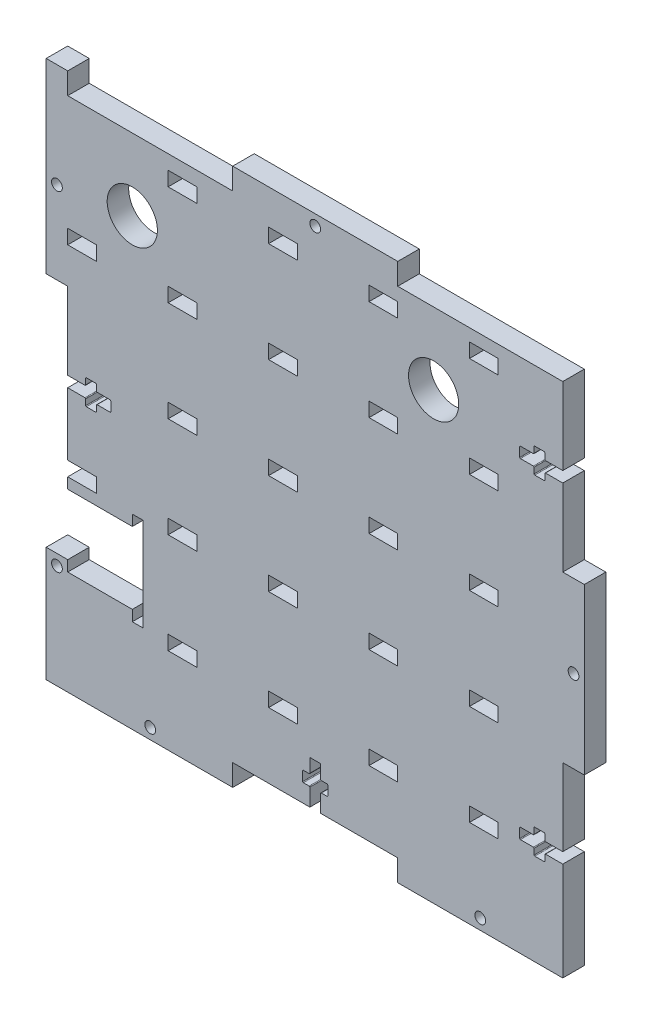
from build123d import *

# Parameters (mm, degrees)
BOX_SIDE_DEPTH       = 6
SKETCH2_R            = 1.5
SCREW_CUT_OUTS_DEPTH = 107.235587258
CUT_EXTRUDE1_DEPTH   = 107.235587258
SKETCH4_W            = 8
SKETCH4_H            = 4
CUT_EXTRUDE2_DEPTH   = 107.235587258
SKETCH5_R            = 7
CUT_EXTRUDE3_DEPTH   = 107.235587258
SKETCH6_W            = 6
SKETCH6_H            = 6
BOSS_EXTRUDE1_DEPTH  = 6


with BuildPart() as part:
    # Sketch1 → Box Side (new body)
    with BuildSketch(Plane.XY):
        Polygon((-69, 69), (-23, 69), (-23, 75), (23, 75), (23, 69), (69, 69), (69, 23), (75, 23), (75, -23), (69, -23), (69, -69), (69, -75), (23, -75), (23, -69), (-23, -69), (-23, -75), (-69, -75), (-75, -75), (-75, -69), (-75, -23), (-69, -23), (-69, 23), (-75, 23), (-75, 69), align=None)
    extrude(amount=BOX_SIDE_DEPTH)

    # Sketch2 → Screw Cut-outs (cut, through all)
    with BuildSketch(Plane.XY.offset(6)):
        with Locations((0, 72)):
            Circle(SKETCH2_R)
        with Locations((72, 0)):
            Circle(SKETCH2_R)
        with Locations((-46, -72)):
            Circle(SKETCH2_R)
        with Locations((46, -72)):
            Circle(SKETCH2_R)
        with Locations((-72, 46)):
            Circle(SKETCH2_R)
        with Locations((-72, -46)):
            Circle(SKETCH2_R)
        with BuildLine():
            Line((69, 44.5), (64.2, 44.5))
            ThreePointArc((64.2, 44.5), (64.058578644, 44.441421356), (64, 44.3))
            Line((64, 44.3), (64, 42.7))
            ThreePointArc((64, 42.7), (63.941421356, 42.558578644), (63.8, 42.5))
            Line((63.8, 42.5), (61.2, 42.5))
            ThreePointArc((61.2, 42.5), (61.058578644, 42.558578644), (61, 42.7))
            Line((61, 42.7), (61, 44.3))
            ThreePointArc((61, 44.3), (60.941421356, 44.441421356), (60.8, 44.5))
            Line((60.8, 44.5), (57.2, 44.5))
            ThreePointArc((57.2, 44.5), (57.058578644, 44.558578644), (57, 44.7))
            Line((57, 44.7), (57, 47.3))
            ThreePointArc((57, 47.3), (57.058578644, 47.441421356), (57.2, 47.5))
            Line((57.2, 47.5), (60.8, 47.5))
            ThreePointArc((60.8, 47.5), (60.941421356, 47.558578644), (61, 47.7))
            Line((61, 47.7), (61, 49.3))
            ThreePointArc((61, 49.3), (61.058578644, 49.441421356), (61.2, 49.5))
            Line((61.2, 49.5), (63.8, 49.5))
            ThreePointArc((63.8, 49.5), (63.941421356, 49.441421356), (64, 49.3))
            Line((64, 49.3), (64, 47.7))
            ThreePointArc((64, 47.7), (64.058578644, 47.558578644), (64.2, 47.5))
            Line((64.2, 47.5), (69, 47.5))
            Line((69, 47.5), (69, 44.5))
        make_face()
        with BuildLine():
            Line((69, -47.5), (64.2, -47.5))
            ThreePointArc((64.2, -47.5), (64.058578644, -47.558578644), (64, -47.7))
            Line((64, -47.7), (64, -49.3))
            ThreePointArc((64, -49.3), (63.941421356, -49.441421356), (63.8, -49.5))
            Line((63.8, -49.5), (61.2, -49.5))
            ThreePointArc((61.2, -49.5), (61.058578644, -49.441421356), (61, -49.3))
            Line((61, -49.3), (61, -47.7))
            ThreePointArc((61, -47.7), (60.941421356, -47.558578644), (60.8, -47.5))
            Line((60.8, -47.5), (57.2, -47.5))
            ThreePointArc((57.2, -47.5), (57.058578644, -47.441421356), (57, -47.3))
            Line((57, -47.3), (57, -44.7))
            ThreePointArc((57, -44.7), (57.058578644, -44.558578644), (57.2, -44.5))
            Line((57.2, -44.5), (60.8, -44.5))
            ThreePointArc((60.8, -44.5), (60.941421356, -44.441421356), (61, -44.3))
            Line((61, -44.3), (61, -42.7))
            ThreePointArc((61, -42.7), (61.058578644, -42.558578644), (61.2, -42.5))
            Line((61.2, -42.5), (63.8, -42.5))
            ThreePointArc((63.8, -42.5), (63.941421356, -42.558578644), (64, -42.7))
            Line((64, -42.7), (64, -44.3))
            ThreePointArc((64, -44.3), (64.058578644, -44.441421356), (64.2, -44.5))
            Line((64.2, -44.5), (69, -44.5))
            Line((69, -44.5), (69, -47.5))
        make_face()
        with BuildLine():
            Line((-1.5, -69), (1.5, -69))
            Line((1.5, -69), (1.5, -64.2))
            ThreePointArc((1.5, -64.2), (1.558578644, -64.058578644), (1.7, -64))
            Line((1.7, -64), (3.3, -64))
            ThreePointArc((3.3, -64), (3.441421356, -63.941421356), (3.5, -63.8))
            Line((3.5, -63.8), (3.5, -61.2))
            ThreePointArc((3.5, -61.2), (3.441421356, -61.058578644), (3.3, -61))
            Line((3.3, -61), (1.7, -61))
            ThreePointArc((1.7, -61), (1.558578644, -60.941421356), (1.5, -60.8))
            Line((1.5, -60.8), (1.5, -57.2))
            ThreePointArc((1.5, -57.2), (1.441421356, -57.058578644), (1.3, -57))
            Line((1.3, -57), (-1.3, -57))
            ThreePointArc((-1.3, -57), (-1.441421356, -57.058578644), (-1.5, -57.2))
            Line((-1.5, -57.2), (-1.5, -60.8))
            ThreePointArc((-1.5, -60.8), (-1.558578644, -60.941421356), (-1.7, -61))
            Line((-1.7, -61), (-3.3, -61))
            ThreePointArc((-3.3, -61), (-3.441421356, -61.058578644), (-3.5, -61.2))
            Line((-3.5, -61.2), (-3.5, -63.8))
            ThreePointArc((-3.5, -63.8), (-3.441421356, -63.941421356), (-3.3, -64))
            Line((-3.3, -64), (-1.7, -64))
            ThreePointArc((-1.7, -64), (-1.558578644, -64.058578644), (-1.5, -64.2))
            Line((-1.5, -64.2), (-1.5, -69))
        make_face()
        with BuildLine():
            Line((-69, -1.5), (-64.2, -1.5))
            ThreePointArc((-64.2, -1.5), (-64.058578644, -1.558578644), (-64, -1.7))
            Line((-64, -1.7), (-64, -3.3))
            ThreePointArc((-64, -3.3), (-63.941421356, -3.441421356), (-63.8, -3.5))
            Line((-63.8, -3.5), (-61.2, -3.5))
            ThreePointArc((-61.2, -3.5), (-61.058578644, -3.441421356), (-61, -3.3))
            Line((-61, -3.3), (-61, -1.7))
            ThreePointArc((-61, -1.7), (-60.941421356, -1.558578644), (-60.8, -1.5))
            Line((-60.8, -1.5), (-57.2, -1.5))
            ThreePointArc((-57.2, -1.5), (-57.058578644, -1.441421356), (-57, -1.3))
            Line((-57, -1.3), (-57, 1.3))
            ThreePointArc((-57, 1.3), (-57.058578644, 1.441421356), (-57.2, 1.5))
            Line((-57.2, 1.5), (-60.8, 1.5))
            ThreePointArc((-60.8, 1.5), (-60.941421356, 1.558578644), (-61, 1.7))
            Line((-61, 1.7), (-61, 3.3))
            ThreePointArc((-61, 3.3), (-61.058578644, 3.441421356), (-61.2, 3.5))
            Line((-61.2, 3.5), (-63.8, 3.5))
            ThreePointArc((-63.8, 3.5), (-63.941421356, 3.441421356), (-64, 3.3))
            Line((-64, 3.3), (-64, 1.7))
            ThreePointArc((-64, 1.7), (-64.058578644, 1.558578644), (-64.2, 1.5))
            Line((-64.2, 1.5), (-69, 1.5))
            Line((-69, 1.5), (-69, -1.5))
        make_face()
    extrude(amount=-SCREW_CUT_OUTS_DEPTH, mode=Mode.SUBTRACT)

    # Sketch3 → Cut-Extrude1 (cut, through all)
    with BuildSketch(Plane.XY.offset(6)):
        Polygon((-51, -46), (-51, -49), (-48, -49), (-48, -23), (-51, -23), (-51, -26), (-69, -26), (-69, -23), (-75, -23), (-75, -43), (-69, -43), (-69, -46), align=None)
    extrude(amount=-CUT_EXTRUDE1_DEPTH, mode=Mode.SUBTRACT)

    # Sketch4 → Cut-Extrude2 (cut, through all)
    with BuildSketch(Plane.XY.offset(6)):
        with Locations((-37, 63)):
            Rectangle(SKETCH4_W, SKETCH4_H)
        with Locations((-37, 35)):
            Rectangle(SKETCH4_W, SKETCH4_H)
        with Locations((-65, 35)):
            Rectangle(SKETCH4_W, SKETCH4_H)
        with Locations((19, 35.283560436)):
            Rectangle(SKETCH4_W, SKETCH4_H)
        with Locations((-9, 35.283560436)):
            Rectangle(SKETCH4_W, SKETCH4_H)
        with Locations((-9, 63.283560436)):
            Rectangle(SKETCH4_W, SKETCH4_H)
        with Locations((19, 63.283560436)):
            Rectangle(SKETCH4_W, SKETCH4_H)
        with Locations((47, 35.567120872)):
            Rectangle(SKETCH4_W, SKETCH4_H)
        with Locations((47, 63.567120872)):
            Rectangle(SKETCH4_W, SKETCH4_H)
        with Locations((19, -20.716439564)):
            Rectangle(SKETCH4_W, SKETCH4_H)
        with Locations((-9, -20.716439564)):
            Rectangle(SKETCH4_W, SKETCH4_H)
        with Locations((-9, 7.283560436)):
            Rectangle(SKETCH4_W, SKETCH4_H)
        with Locations((19, 7.283560436)):
            Rectangle(SKETCH4_W, SKETCH4_H)
        with Locations((47, -20.432879128)):
            Rectangle(SKETCH4_W, SKETCH4_H)
        with Locations((47, 7.567120872)):
            Rectangle(SKETCH4_W, SKETCH4_H)
        with Locations((-9, -48.716439564)):
            Rectangle(SKETCH4_W, SKETCH4_H)
        with Locations((19, -48.716439564)):
            Rectangle(SKETCH4_W, SKETCH4_H)
        with Locations((47, -48.432879128)):
            Rectangle(SKETCH4_W, SKETCH4_H)
        with Locations((-37, -21)):
            Rectangle(SKETCH4_W, SKETCH4_H)
        with Locations((-65, -21)):
            Rectangle(SKETCH4_W, SKETCH4_H)
        with Locations((-37, 7)):
            Rectangle(SKETCH4_W, SKETCH4_H)
        with Locations((-37, -49)):
            Rectangle(SKETCH4_W, SKETCH4_H)
    extrude(amount=-CUT_EXTRUDE2_DEPTH, mode=Mode.SUBTRACT)

    # Sketch5 → Cut-Extrude3 (cut, through all)
    with BuildSketch(Plane.XY.offset(6)):
        with Locations((-51, 49)):
            Circle(SKETCH5_R)
        with Locations((33, 49)):
            Circle(SKETCH5_R)
    extrude(amount=-CUT_EXTRUDE3_DEPTH, mode=Mode.SUBTRACT)

    # Sketch6 → Boss-Extrude1 (add)
    with BuildSketch(Plane.XY.offset(6)):
        with Locations((-72, 72)):
            Rectangle(SKETCH6_W, SKETCH6_H)
    extrude(amount=-BOSS_EXTRUDE1_DEPTH)


solid = part.part
